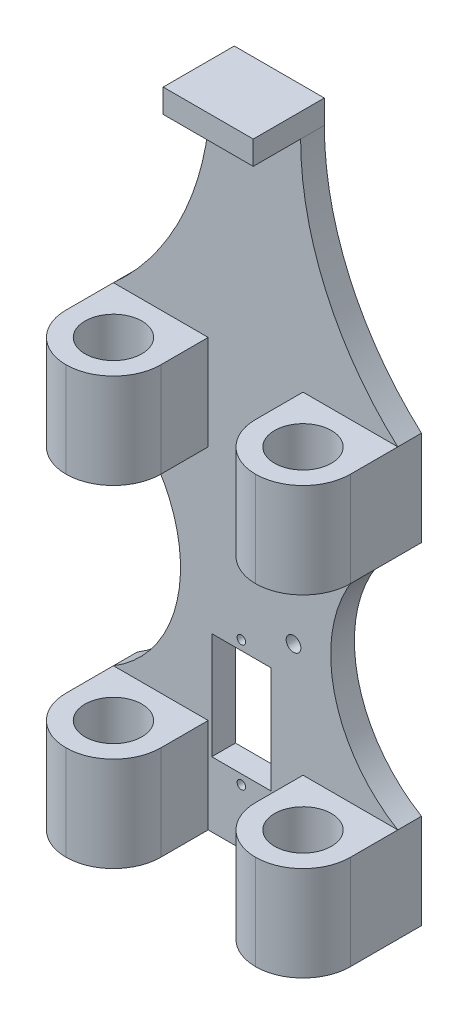
from build123d import *

# Parameters (mm, degrees)
SKETCH1_W           = 60
SKETCH1_H           = 90
SKETCH1_R           = 0.9
SKETCH1_R_2         = 1.55
SKETCH1_W_2         = 12.5
SKETCH1_H_2         = 22.5
BOSS_EXTRUDE1_DEPTH = 5
SKETCH2_W           = 20
SKETCH2_H           = 20
BOSS_EXTRUDE2_DEPTH = 20
FILLET1_R           = 10
SKETCH3_R           = 6
CUT_EXTRUDE1_DEPTH  = 99.107084352
CUT_EXTRUDE2_REACH  = 59.663
SKETCH5_W           = 60
SKETCH5_H           = 5
BOSS_EXTRUDE3_DEPTH = 51
CUT_EXTRUDE3_REACH  = 104.548
SKETCH7_W           = 19
SKETCH7_H           = 5
BOSS_EXTRUDE4_DEPTH = 10


with BuildPart() as part:
    # Sketch1 → Boss-Extrude1 (new body)
    with BuildSketch(Plane.XY):
        Rectangle(SKETCH1_W, SKETCH1_H)
        with Locations((-3, -33.25)):
            Circle(SKETCH1_R, mode=Mode.SUBTRACT)
        with Locations((-3, -6.75)):
            Circle(SKETCH1_R, mode=Mode.SUBTRACT)
        with Locations((8, -38)):
            Circle(SKETCH1_R_2, mode=Mode.SUBTRACT)
        with Locations((8, -2)):
            Circle(SKETCH1_R_2, mode=Mode.SUBTRACT)
        with Locations((-3, -20)):
            Rectangle(SKETCH1_W_2, SKETCH1_H_2, mode=Mode.SUBTRACT)
    extrude(amount=BOSS_EXTRUDE1_DEPTH)

    # Sketch2 → Boss-Extrude2 (add)
    with BuildSketch(Plane.XY.offset(5)):
        with Locations((-20, -35)):
            Rectangle(SKETCH2_W, SKETCH2_H)
        with Locations((-20, 35)):
            Rectangle(SKETCH2_W, SKETCH2_H)
        with Locations((20, 35)):
            Rectangle(SKETCH2_W, SKETCH2_H)
        with Locations((20, -35)):
            Rectangle(SKETCH2_W, SKETCH2_H)
    extrude(amount=BOSS_EXTRUDE2_DEPTH)

    # Fillet1
    fillet1_edges = [part.edges().sort_by_distance(p)[0] for p in [
        (10, -35, 25),
        (30, -35, 25),
        (30, 35, 25),
        (10, 35, 25),
        (-30, 35, 25),
        (-10, 35, 25),
        (-10, -35, 25),
        (-30, -35, 25),
    ]]
    fillet(fillet1_edges, radius=FILLET1_R - 0.0001)  # a hair under: the kernel refuses the full size

    # Sketch3 → Cut-Extrude1 (cut, through all)
    with BuildSketch(Plane.XZ.offset(45)):
        with Locations(Location((-20, 15, 0), (0, 0, 270))):
            Circle(SKETCH3_R)
        with Locations(Location((20, 15, 0), (0, 0, 270))):
            Circle(SKETCH3_R)
    extrude(amount=-CUT_EXTRUDE1_DEPTH, mode=Mode.SUBTRACT)

    # Sketch4 → Cut-Extrude2 (cut, up to next)
    with BuildSketch(Plane.XY.offset(5), mode=Mode.PRIVATE) as cut_extrude2_sk1:
        with BuildLine():
            Line((-30, 25), (-30, -25))
            ThreePointArc((-30, -25), (-15.845240526, 0), (-30, 25))
        make_face()
    cut_extrude2_tool1 = extrude(cut_extrude2_sk1.sketch, amount=-CUT_EXTRUDE2_REACH, mode=Mode.PRIVATE) & part.part
    # Sketch4 → Cut-Extrude2 (cut, up to next)
    with BuildSketch(Plane.XY.offset(5), mode=Mode.PRIVATE) as cut_extrude2_sk2:
        with BuildLine():
            Line((30, 25), (30, -25))
            ThreePointArc((30, -25), (15.845240526, 0), (30, 25))
        make_face()
    cut_extrude2_tool2 = extrude(cut_extrude2_sk2.sketch, amount=-CUT_EXTRUDE2_REACH, mode=Mode.PRIVATE) & part.part
    add(cut_extrude2_tool1.solids().sort_by_distance((-24.20079, 0, 5))[0], mode=Mode.SUBTRACT)
    add(cut_extrude2_tool2.solids().sort_by_distance((24.20079, 0, 5))[0], mode=Mode.SUBTRACT)

    # Sketch5 → Boss-Extrude3 (add)
    with BuildSketch(Plane(origin=(0, 45, 0), x_dir=(1, 0, 0), z_dir=(0, 1, 0))):
        with Locations((0, -2.5)):
            Rectangle(SKETCH5_W, SKETCH5_H)
    extrude(amount=BOSS_EXTRUDE3_DEPTH)

    # Sketch6 → Cut-Extrude3 (cut, up to next)
    with BuildSketch(Plane.XY.offset(5), mode=Mode.PRIVATE) as cut_extrude3_sk1:
        with BuildLine():
            Line((-9.5, 91), (-9.5, 96))
            Line((-9.5, 96), (-30, 96))
            Line((-30, 96), (-30, 45))
            ThreePointArc((-30, 45), (-14.856951526, 65.819402311), (-9.5, 91))
        make_face()
    cut_extrude3_tool1 = extrude(cut_extrude3_sk1.sketch, amount=-CUT_EXTRUDE3_REACH, mode=Mode.PRIVATE) & part.part
    # Sketch6 → Cut-Extrude3 (cut, up to next)
    with BuildSketch(Plane.XY.offset(5), mode=Mode.PRIVATE) as cut_extrude3_sk2:
        with BuildLine():
            Line((9.5, 91), (9.5, 96))
            Line((9.5, 96), (30, 96))
            Line((30, 96), (30, 45))
            ThreePointArc((30, 45), (14.856951526, 65.819402311), (9.5, 91))
        make_face()
    cut_extrude3_tool2 = extrude(cut_extrude3_sk2.sketch, amount=-CUT_EXTRUDE3_REACH, mode=Mode.PRIVATE) & part.part
    add(cut_extrude3_tool1.solids().sort_by_distance((-21.41045, 76.034299, 5))[0], mode=Mode.SUBTRACT)
    add(cut_extrude3_tool2.solids().sort_by_distance((21.41045, 76.034299, 5))[0], mode=Mode.SUBTRACT)

    # Sketch7 → Boss-Extrude4 (add)
    with BuildSketch(Plane.XY.offset(5)):
        with Locations((0, 93.5)):
            Rectangle(SKETCH7_W, SKETCH7_H)
    extrude(amount=BOSS_EXTRUDE4_DEPTH)


solid = part.part
